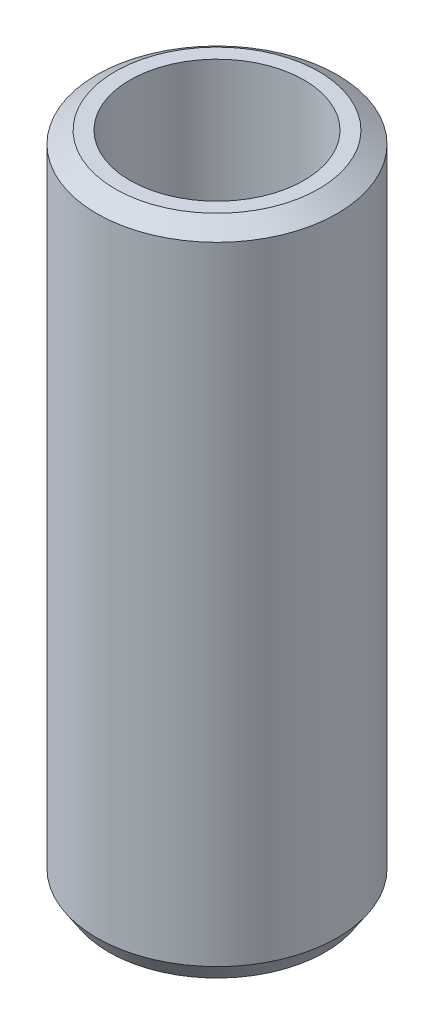
from build123d import *
from OCP.BRepFilletAPI import BRepFilletAPI_MakeChamfer

# Parameters (mm, degrees)
SKETCH1_R           = 25
BOSS_EXTRUDE1_DEPTH = 136.762048514
SKETCH2_R           = 18.092824468
CUT_EXTRUDE1_DEPTH  = 142.258125125
CHAMFER1_SIZE       = 2.518829841
CHAMFER1_SIZE2      = 3.836492066


with BuildPart() as part:
    # Sketch1 → Boss-Extrude1 (new body)
    with BuildSketch(Plane(origin=(0, 0, 0), x_dir=(1, 0, 0), z_dir=(0, 1, 0))):
        Circle(SKETCH1_R)
    extrude(amount=BOSS_EXTRUDE1_DEPTH)

    # Sketch2 → Cut-Extrude1 (cut, through all)
    with BuildSketch(Plane(origin=(0, 0, 0), x_dir=(1, 0, 0), z_dir=(0, 1, 0))):
        Circle(SKETCH2_R)
    extrude(amount=CUT_EXTRUDE1_DEPTH, mode=Mode.SUBTRACT)

    # Chamfer1: one chamfer whose edges measure the first distance from different faces: ONE call of the kernel's chamfer builder (chamfer() names one face for all edges)
    chamfer1_edges_1 = [part.edges().sort_by_distance(p)[0] for p in [
        (-25, 136.762048514, 0),
    ]]
    chamfer1_side_1 = [part.faces().sort_by_distance(p)[0] for p in [
        (-25, 68.381024257, 0),
    ]]
    chamfer1_edges_2 = [part.edges().sort_by_distance(p)[0] for p in [
        (-25, 0, 0),
    ]]
    chamfer1_side_2 = [part.faces().sort_by_distance(p)[0] for p in [
        (-24.292893219, 0, 0),
    ]]
    chamfer1 = BRepFilletAPI_MakeChamfer(part.part.solid().wrapped)
    for e in chamfer1_edges_1:
        chamfer1.Add(CHAMFER1_SIZE, CHAMFER1_SIZE2, e.wrapped, chamfer1_side_1[0].wrapped)  # the first distance lies on this face
    for e in chamfer1_edges_2:
        chamfer1.Add(CHAMFER1_SIZE, CHAMFER1_SIZE2, e.wrapped, chamfer1_side_2[0].wrapped)  # the first distance lies on this face
    add(Compound.cast(chamfer1.Shape()), mode=Mode.REPLACE)


solid = part.part
